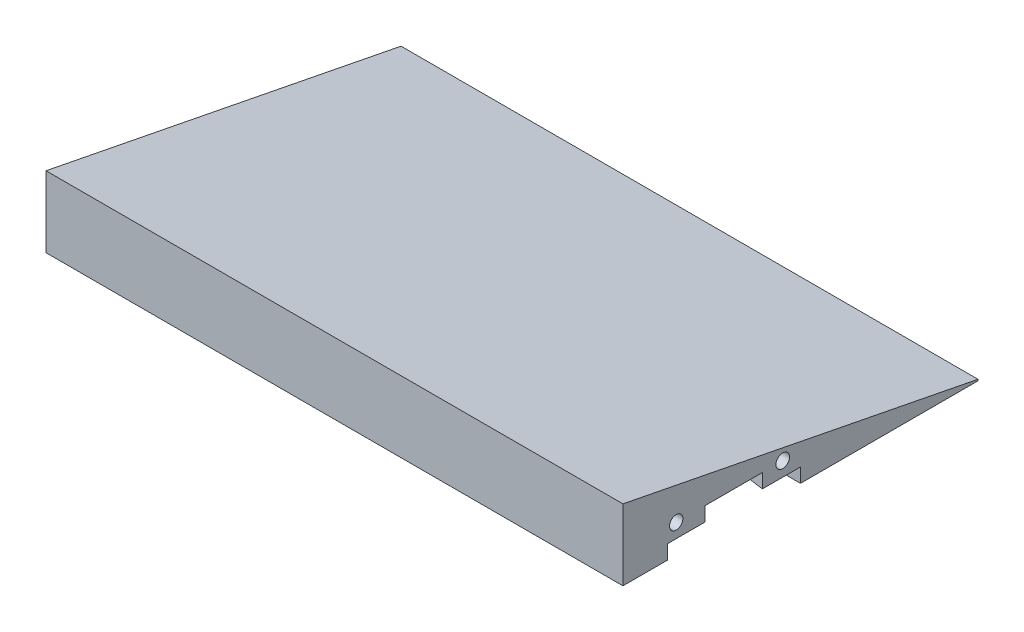
from build123d import *

# Parameters (mm, degrees)
BOSS_EXTRUDE1_DEPTH = 195.58
SKETCH2_R           = 3.3147
CUT_EXTRUDE1_DEPTH  = 38.1
SKETCH3_W           = 38.1
SKETCH3_H           = 4.064
CUT_EXTRUDE2_DEPTH  = 405.649982083
CUT_EXTRUDE3_DEPTH  = 4.064
SKETCH7_W           = 101.6
SKETCH7_H           = 20.540040578
CUT_EXTRUDE5_DEPTH  = 226.06
CUT_EXTRUDE6_DEPTH  = 4.064
SKETCH10_R          = 1.905
SKETCH10_R_2        = 1.949893387
CUT_EXTRUDE7_DEPTH  = 12.7


with BuildPart() as part:
    # Sketch1 → Boss-Extrude1 (new, symmetric)
    with BuildSketch(Plane(origin=(0, 0, 0), x_dir=(0, 0, -1), z_dir=(1, 0, 0))):
        Polygon((0, 0), (0, 20.32), (101.6, 0.4), (101.6, 0), align=None)
    extrude(amount=BOSS_EXTRUDE1_DEPTH, both=True)

    # Sketch2 → Cut-Extrude1 (cut)
    with BuildSketch(Plane(origin=(195.58, 0, 0), x_dir=(0, 0, -1), z_dir=(1, 0, 0))):
        with Locations((8.876362872, 4.7625)):
            Circle(SKETCH2_R)
        with Locations((54.596362872, 4.7625)):
            Circle(SKETCH2_R)
    cut_extrude1 = extrude(amount=-CUT_EXTRUDE1_DEPTH, mode=Mode.SUBTRACT)

    # Mirror3: Cut-Extrude1 across plane
    add(cut_extrude1.mirror(Plane(origin=(0, 0, 0), x_dir=(0, 0, 1), z_dir=(1, 0, 0))), mode=Mode.SUBTRACT)

    # Sketch3 → Cut-Extrude2 (cut, through all)
    with BuildSketch(Plane.ZY.offset(195.58)):
        with Locations((-31.75, 2.032)):
            Rectangle(SKETCH3_W, SKETCH3_H)
    extrude(amount=-CUT_EXTRUDE2_DEPTH, mode=Mode.SUBTRACT)

    # Sketch4 → Cut-Extrude3 (cut)
    with BuildSketch(Plane.XZ):
        Polygon((-144.6784, -50.8), (-146.004023787, -60.232303355), (-144.6784, -60.232303355), (-128.482847573, -60.232303355), (-127.157223787, -60.232303355), (-128.482847573, -50.8), align=None)
        Polygon((-77.479647573, -50.8), (-78.80527136, -60.232303355), (-77.479647573, -60.232303355), (-61.284095147, -60.232303355), (-59.95847136, -60.232303355), (-61.284095147, -50.8), align=None)
        Polygon((-10.280895147, -50.8), (-11.606518933, -60.232303355), (-10.280895147, -60.232303355), (5.91465728, -60.232303355), (7.240281067, -60.232303355), (5.91465728, -50.8), align=None)
        Polygon((56.91785728, -50.8), (55.592233493, -60.232303355), (56.91785728, -60.232303355), (73.113409707, -60.232303355), (74.439033493, -60.232303355), (73.113409707, -50.8), align=None)
        Polygon((124.116609707, -50.8), (122.79098592, -60.232303355), (124.116609707, -60.232303355), (140.312162134, -60.232303355), (141.63778592, -60.232303355), (140.312162134, -50.8), align=None)
        Polygon((124.116609707, -12.7), (140.312162134, -12.7), (141.63778592, -3.267696645), (140.312162134, -3.267696645), (124.116609707, -3.267696645), (122.79098592, -3.267696645), align=None)
        Polygon((56.91785728, -12.7), (73.113409707, -12.7), (74.439033493, -3.267696645), (73.113409707, -3.267696645), (56.91785728, -3.267696645), (55.592233493, -3.267696645), align=None)
        Polygon((-10.280895147, -12.7), (5.91465728, -12.7), (7.240281067, -3.267696645), (5.91465728, -3.267696645), (-10.280895147, -3.267696645), (-11.606518933, -3.267696645), align=None)
        Polygon((-77.479647573, -12.7), (-61.284095147, -12.7), (-59.95847136, -3.267696645), (-61.284095147, -3.267696645), (-77.479647573, -3.267696645), (-78.80527136, -3.267696645), align=None)
        Polygon((-144.6784, -12.7), (-128.482847573, -12.7), (-127.157223787, -3.267696645), (-128.482847573, -3.267696645), (-144.6784, -3.267696645), (-146.004023787, -3.267696645), align=None)
    extrude(amount=-CUT_EXTRUDE3_DEPTH, mode=Mode.SUBTRACT)

    # Sketch7 → Cut-Extrude5 (cut)
    with BuildSketch(Plane(origin=(195.58, 0, 0), x_dir=(0, 0, -1), z_dir=(1, 0, 0))):
        with Locations((50.8, 10.270020289)):
            Rectangle(SKETCH7_W, SKETCH7_H)
    extrude(amount=-CUT_EXTRUDE5_DEPTH, mode=Mode.SUBTRACT)

    # Sketch9 → Cut-Extrude6 (cut)
    with BuildSketch(Plane.XZ.offset(-4.064)):
        Polygon((-30.48, -23.495), (-39.912303355, -22.169376213), (-39.912303355, -41.219376213), (-30.48, -39.893752427), align=None)
    extrude(amount=-CUT_EXTRUDE6_DEPTH, mode=Mode.SUBTRACT)

    # Sketch10 → Cut-Extrude7 (cut)
    with BuildSketch(Plane(origin=(-30.48, 0, 0), x_dir=(0, 0, -1), z_dir=(1, 0, 0))):
        with Locations((15.24, 8.128)):
            Circle(SKETCH10_R)
        with Locations((45.72, 8.128)):
            Circle(SKETCH10_R_2)
    extrude(amount=-CUT_EXTRUDE7_DEPTH, mode=Mode.SUBTRACT)


solid = part.part
